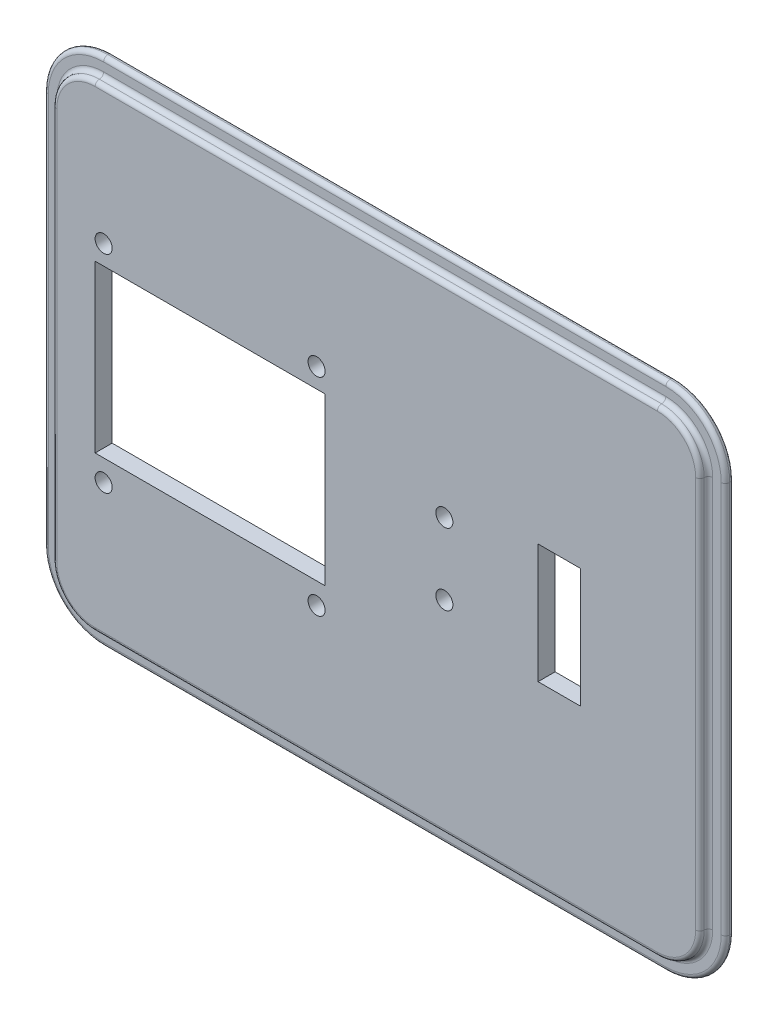
from build123d import *

# Parameters (mm, degrees)
ESQUISSE1_R             = 1
ESQUISSE1_W             = 27
ESQUISSE1_H             = 19.5
ESQUISSE1_W_2           = 5
ESQUISSE1_H_2           = 14
BOSS_EXTRU_1_DEPTH      = 2
ENL_V_START             = -1
ENL_V_MAT_EXTRU_1_DEPTH = 1
CONG_1_R                = 0.5


with BuildPart() as part:
    # Esquisse1 → Boss.-Extru.1 (new body)
    with BuildSketch(Plane.XY):
        with BuildLine():
            Line((33, 30), (-33, 30))
            ThreePointArc((-33, 30), (-37.949747468, 27.949747468), (-40, 23))
            Line((-40, 23), (-40, -23))
            ThreePointArc((-40, -23), (-37.949747468, -27.949747468), (-33, -30))
            Line((-33, -30), (33, -30))
            ThreePointArc((33, -30), (37.949747468, -27.949747468), (40, -23))
            Line((40, -23), (40, 23))
            ThreePointArc((40, 23), (37.949747468, 27.949747468), (33, 30))
        make_face()
        with Locations((-32, 12.05)):
            Circle(ESQUISSE1_R, mode=Mode.SUBTRACT)
        with Locations((-7, 12.05)):
            Circle(ESQUISSE1_R, mode=Mode.SUBTRACT)
        with Locations((-7, -12.25)):
            Circle(ESQUISSE1_R, mode=Mode.SUBTRACT)
        with Locations((-32, -12.25)):
            Circle(ESQUISSE1_R, mode=Mode.SUBTRACT)
        with Locations((8, 4.2)):
            Circle(ESQUISSE1_R, mode=Mode.SUBTRACT)
        with Locations((8, -4.2)):
            Circle(ESQUISSE1_R, mode=Mode.SUBTRACT)
        with Locations((-19.5, 0)):
            Rectangle(ESQUISSE1_W, ESQUISSE1_H, mode=Mode.SUBTRACT)
        with Locations((21.5, 0)):
            Rectangle(ESQUISSE1_W_2, ESQUISSE1_H_2, mode=Mode.SUBTRACT)
    extrude(amount=BOSS_EXTRU_1_DEPTH)

    # Esquisse2 → Enlèv. mat.-Extru.1 (cut)
    with BuildSketch(Plane.XY.offset(2).offset(ENL_V_START)):
        with BuildLine():
            Line((40, -23), (40, 23))
            ThreePointArc((40, 23), (37.949747468, 27.949747468), (33, 30))
            Line((33, 30), (-33, 30))
            ThreePointArc((-33, 30), (-37.949747468, 27.949747468), (-40, 23))
            Line((-40, 23), (-40, -23))
            ThreePointArc((-40, -23), (-37.949747468, -27.949747468), (-33, -30))
            Line((-33, -30), (33, -30))
            ThreePointArc((33, -30), (37.949747468, -27.949747468), (40, -23))
        make_face()
        with BuildLine():
            Line((38, -23), (38, 23))
            ThreePointArc((38, 23), (36.535533906, 26.535533906), (33, 28))
            Line((33, 28), (-33, 28))
            ThreePointArc((-33, 28), (-36.535533906, 26.535533906), (-38, 23))
            Line((-38, 23), (-38, -23))
            ThreePointArc((-38, -23), (-36.535533906, -26.535533906), (-33, -28))
            Line((-33, -28), (33, -28))
            ThreePointArc((33, -28), (36.535533906, -26.535533906), (38, -23))
        make_face(mode=Mode.SUBTRACT)
    extrude(amount=ENL_V_MAT_EXTRU_1_DEPTH, mode=Mode.SUBTRACT)

    # Congé1
    cong_1_edges = [part.edges().sort_by_distance(p)[0] for p in [
        (37.949747468, 27.949747468, 0),
        (40, 0, 0),
        (37.949747468, -27.949747468, 0),
        (0, -30, 0),
        (-37.949747468, -27.949747468, 0),
        (-40, 0, 0),
        (-37.949747468, 27.949747468, 0),
        (37.949747468, 27.949747468, 1),
        (40, 0, 1),
        (37.949747468, -27.949747468, 1),
        (0, -30, 1),
        (-37.949747468, -27.949747468, 1),
        (-40, 0, 1),
        (-37.949747468, 27.949747468, 1),
        (36.535533906, 26.535533906, 2),
        (38, 0, 2),
        (36.535533906, -26.535533906, 2),
        (0, -28, 2),
        (-36.535533906, -26.535533906, 2),
        (-38, 0, 2),
        (-36.535533906, 26.535533906, 2),
        (36.535533906, 26.535533906, 1),
        (38, 0, 1),
        (36.535533906, -26.535533906, 1),
        (0, -28, 1),
        (-36.535533906, -26.535533906, 1),
        (-38, 0, 1),
        (-36.535533906, 26.535533906, 1),
        (0, 30, 0),
        (0, 30, 1),
        (0, 28, 2),
        (0, 28, 1),
    ]]
    fillet(cong_1_edges, radius=CONG_1_R - 0.0001)  # a hair under: the kernel refuses the full size


solid = part.part
